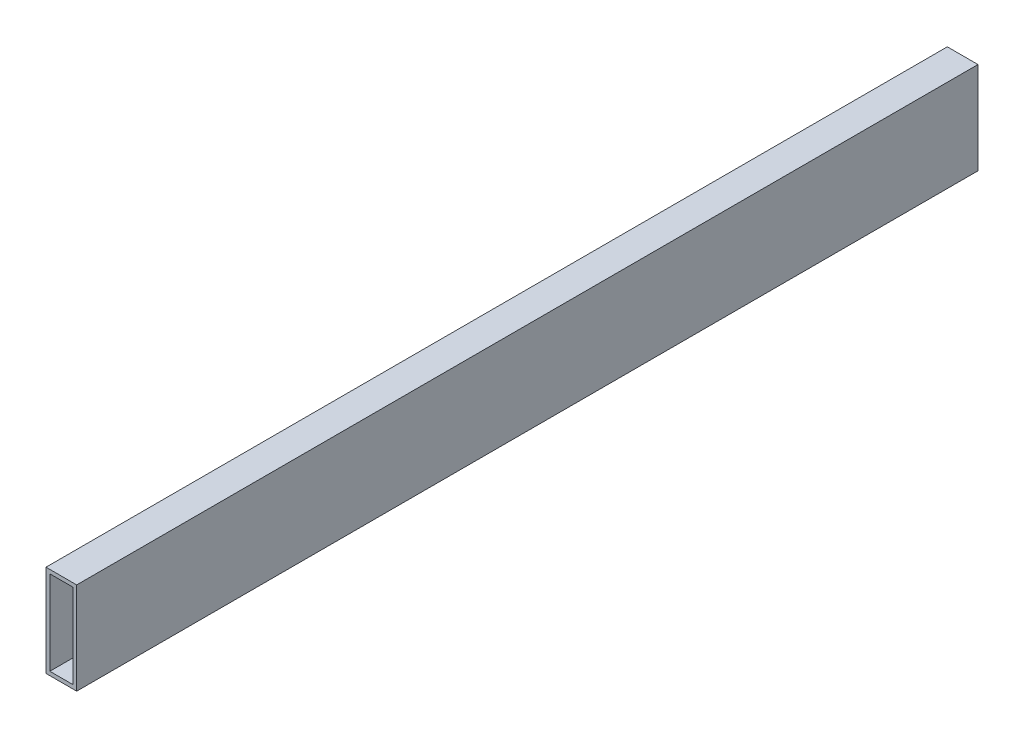
from build123d import *

# Parameters (mm, degrees)
SKETCH1_W           = 25.4
SKETCH1_H           = 76.2
BOSS_EXTRUDE1_DEPTH = 372.999
SHELL1_T            = -3.175


with BuildPart() as part:
    # Sketch1 → Boss-Extrude1 (new, symmetric)
    with BuildSketch(Plane.XY):
        Rectangle(SKETCH1_W, SKETCH1_H)
    extrude(amount=BOSS_EXTRUDE1_DEPTH, both=True)

    # Shell1
    shell1_openings = [part.faces().sort_by_distance(p)[0] for p in [
        (0, 0, -372.999),
        (0, 0, 372.999),
    ]]
    offset(amount=SHELL1_T, openings=shell1_openings, kind=Kind.INTERSECTION)


solid = part.part
